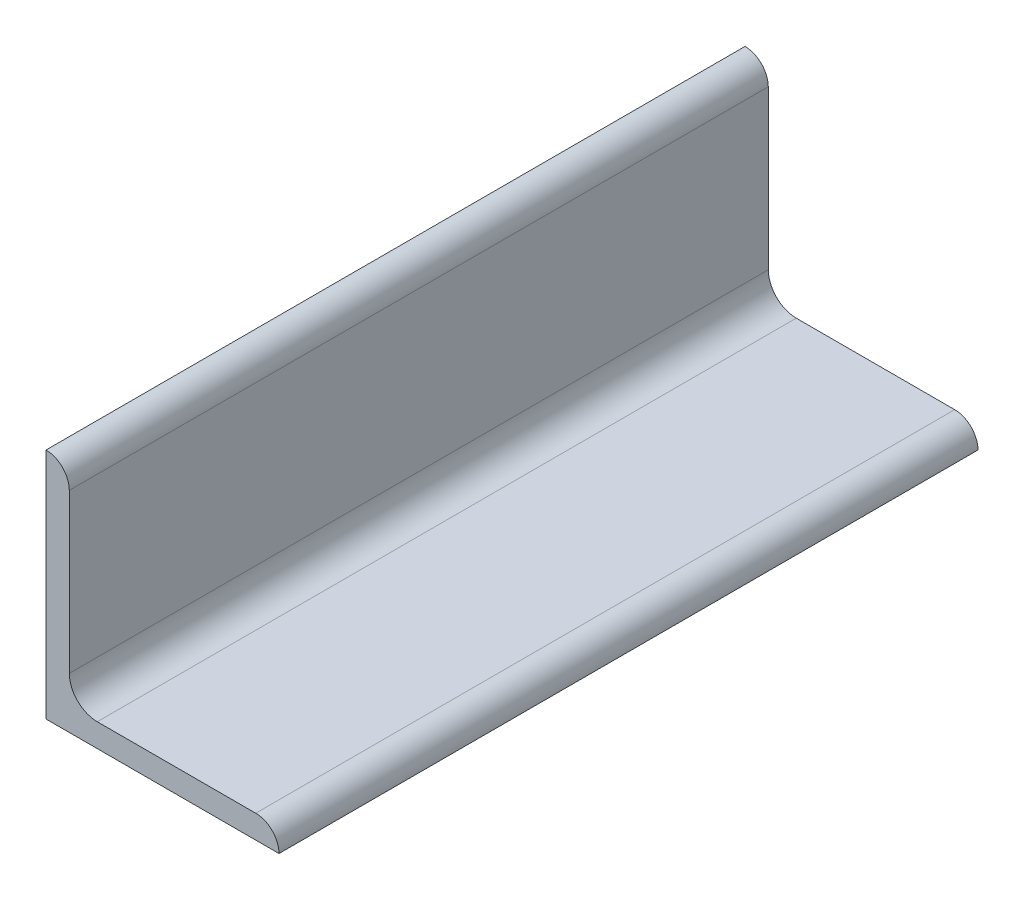
from build123d import *

# Parameters (mm, degrees)
BASESTEELANGLE_DEPTH = 150
TOEFILLET_R          = 10


with BuildPart() as part:
    # Sketch1 → BaseSteelAngle (new, symmetric)
    with BuildSketch(Plane.XY):
        with BuildLine():
            Line((0, 100), (0, 0))
            Line((0, 0), (100, 0))
            Line((100, 0), (100, 10))
            Line((100, 10), (22, 10))
            ThreePointArc((22, 10), (13.514718626, 13.514718626), (10, 22))
            Line((10, 22), (10, 100))
            Line((10, 100), (0, 100))
        make_face()
    extrude(amount=BASESTEELANGLE_DEPTH, both=True)

    # ToeFillet
    toefillet_edges = [part.edges().sort_by_distance(p)[0] for p in [
        (10, 100, 0),
        (100, 10, 0),
    ]]
    fillet(toefillet_edges, radius=TOEFILLET_R - 0.0001)  # a hair under: the kernel refuses the full size


solid = part.part
